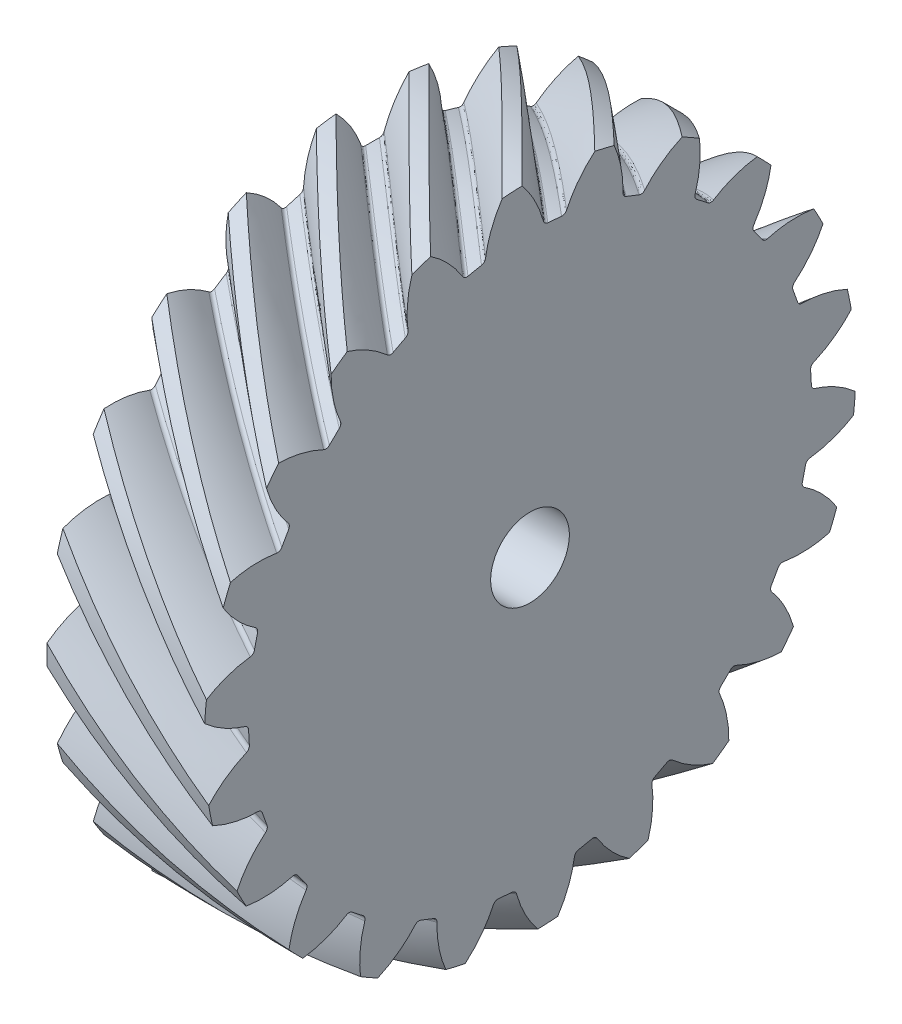
from build123d import *

# Parameters (mm, degrees)
BASPROSKE_W            = 10
BASPROSKE_H            = 20.695436483
TOOTHCUTRH_PITCH       = 130.033262433
TOOTHCUTRH_HEIGHT      = 10
TOOTHCUTRH_RADIUS      = 20.695436483
TOOTHCUTRH_START_ANGLE = -90
TEETHCUTSRH_COUNT      = 22
TEETHCUTSRH_ANGLE      = 343.636363636
BORSKE_R               = 2.5
BORE_DEPTH             = 62.5000025


with BuildPart() as part:
    # BasProSke → Base-Revolve (revolve)
    with BuildSketch(Plane(origin=(0, 0, 0), x_dir=(1, 0, 0), z_dir=(0, 1, 0)), mode=Mode.PRIVATE) as base_revolve_sk:
        with Locations((5, 10.347718242)):
            Rectangle(BASPROSKE_W, BASPROSKE_H)
    revolve(base_revolve_sk.sketch.rotate(Axis((-10, 0, 0), (1, 0, 0)), 180), axis=Axis((-10, 0, 0), (1, 0, 0)))

    # ToothCutRH: sweep along a helix
    with BuildLine() as toothcutrh_path:
        add(Helix(TOOTHCUTRH_PITCH, TOOTHCUTRH_HEIGHT, TOOTHCUTRH_RADIUS, center=(0, 0, 0), direction=(1, 0, 0), mode=Mode.PRIVATE).rotate(Axis((0, 0, 0), (1, 0, 0)), TOOTHCUTRH_START_ANGLE))
    # TooCutSkeRH → ToothCutRH (sweep, cut)
    with BuildSketch(Plane(origin=(0, 0, 0), x_dir=(0, 0, -1), z_dir=(1, 0, 0))):
        with BuildLine():
            ThreePointArc((0.437803293, 17.877576612), (0, 17.882936483), (-0.437803293, 17.877576612))
            ThreePointArc((-0.437803293, 17.877576612), (-0.621913155, 17.931843719), (-0.73988594, 18.083249736))
            ThreePointArc((-0.73988594, 18.083249736), (-1.626011023, 19.750410885), (-2.932224065, 21.11366121))
            ThreePointArc((-2.932224065, 21.11366121), (0, 21.316299577), (2.932224065, 21.11366121))
            ThreePointArc((2.932224065, 21.11366121), (1.626011023, 19.750410885), (0.73988594, 18.083249736))
            ThreePointArc((0.73988594, 18.083249736), (0.621913155, 17.931843719), (0.437803293, 17.877576612))
        make_face()
    toothcutrh = sweep(path=toothcutrh_path.line, is_frenet=True, mode=Mode.SUBTRACT)

    # TeethCutsRH: ToothCutRH ×22 about axis
    teethcutsrh_axis = Axis((-10, 0, 0), (1, 0, 0))
    for i in range(1, TEETHCUTSRH_COUNT):
        add(toothcutrh.rotate(teethcutsrh_axis, i * TEETHCUTSRH_ANGLE / (TEETHCUTSRH_COUNT - 1)), mode=Mode.SUBTRACT)

    # BorSke → Bore (cut, symmetric)
    with BuildSketch(Plane(origin=(0, 0, 0), x_dir=(0, 0, -1), z_dir=(1, 0, 0))):
        with Locations(Location((0, 0, 0), (0, 0, 180))):
            Circle(BORSKE_R)
    extrude(amount=BORE_DEPTH, both=True, mode=Mode.SUBTRACT)


solid = part.part
